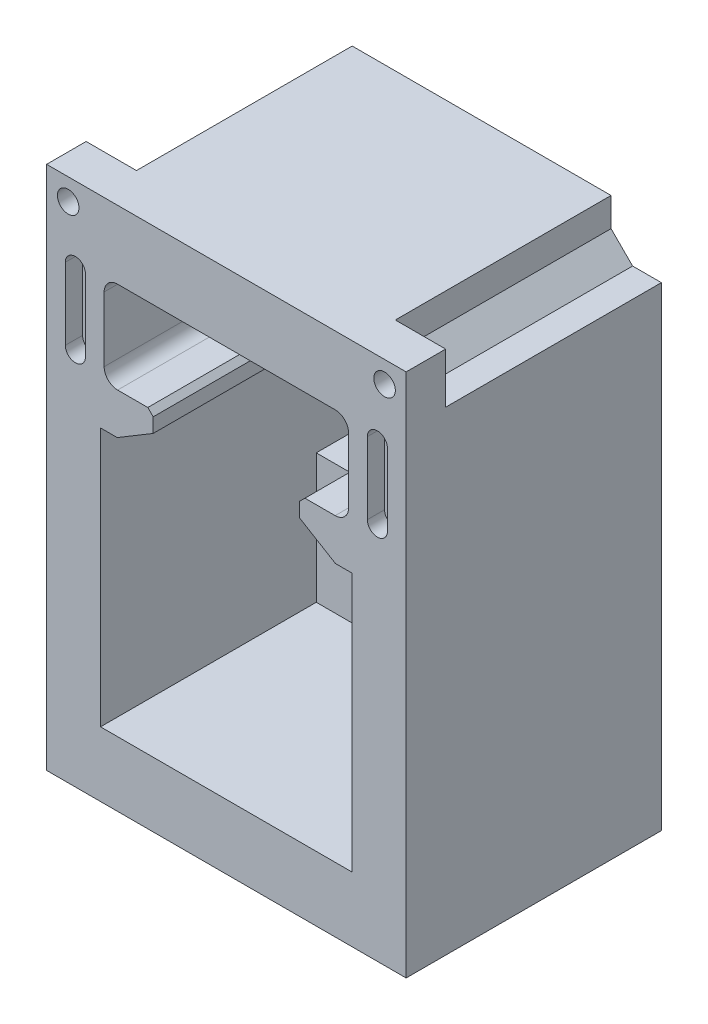
from build123d import *

# Parameters (mm, degrees)
BOSS_EXTRU_1_DEPTH      = 20
CONG_1_R                = 2.38125
ESQUISSE2_W             = 63.5
ESQUISSE2_H             = 35.56
BOSS_EXTRU_2_DEPTH      = 5.08
EMPREINTE1_START        = -25.08
EMPREINTE1_DEPTH        = 5.08
D_PLACER_START          = -25.08
D_PLACER_LA_FACE1_DEPTH = 5.08
EMPREINTE4_START        = 17.46
EMPREINTE4_DEPTH        = 2.54
D_PLACER_START_2        = 16.952
D_PLACER_LA_FACE2_DEPTH = 3.048
CHANFREIN1_SIZE         = 6.35
CHANFREIN1_SIZE2        = 3.81
CHANFREIN2_SIZE         = 3.81
CHANFREIN2_SIZE2        = 6.35
BOSS_EXTRU_3_DEPTH      = 45.08
ESQUISSE4_W             = 44.45
ESQUISSE4_H             = 22.86
ENL_V_MAT_EXTRU_1_DEPTH = 38.1
ESQUISSE5_W             = 12.7
ESQUISSE5_H             = 3.81
BOSS_EXTRU_4_DEPTH      = 12.7
CONG_2_R                = 2.54
D_GAGEMENT_61_D         = 3.7973
ENL_V_START             = -38.1
ENL_V_MAT_EXTRU_2_DEPTH = 119.894566185
D_GAGEMENT_62_D         = 3.7973
D_GAGEMENT_62_DEPTH     = 18.796
D_GAGEMENT_62_TIP       = 1.140824014


# Read off the part's stored shape, not the designer's step: Empreinte1, Déplacer la face1, Empreinte4, Déplacer la face2
with BuildPart() as part:
    # Esquisse1 → Boss.-Extru.1 (new, symmetric)
    with BuildSketch(Plane.XY):
        Polygon((-31.75, -1.905), (-31.75, 33.655), (31.75, 33.655), (31.75, -1.905), (12.92225, -1.905), (12.92225, 4.445), (13.87475, 5.3975), (21.59, 5.3975), (21.59, 21.59), (-21.59, 21.59), (-21.59, 5.3975), (-13.87475, 5.3975), (-12.92225, 4.445), (-12.92225, -1.905), align=None)
    extrude(amount=BOSS_EXTRU_1_DEPTH, both=True)

    # Congé1
    cong_1_edges = [part.edges().sort_by_distance(p)[0] for p in [
        (21.59, 5.3975, 0),
        (21.59, 21.59, 0),
        (-21.59, 21.59, 0),
        (-21.59, 5.3975, 0),
    ]]
    fillet(cong_1_edges, radius=CONG_1_R)

    # Esquisse2 → Boss.-Extru.2 (add)
    with BuildSketch(Plane(origin=(0, 0, -20), x_dir=(-1, 0, 0), z_dir=(0, 0, -1))):
        with Locations((0, 15.875)):
            Rectangle(ESQUISSE2_W, ESQUISSE2_H)
    extrude(amount=BOSS_EXTRU_2_DEPTH)

    # Empreinte1 outline → Empreinte1 (cut)
    with BuildSketch(Plane.XY.offset(EMPREINTE1_START)):
        with BuildLine():
            Line((14.44625, 7.9375), (16.66875, 7.9375))
            ThreePointArc((16.66875, 7.9375), (17.366201977, 9.621298023), (19.05, 10.31875))
            Line((19.05, 10.31875), (19.05, 16.66875))
            ThreePointArc((19.05, 16.66875), (17.366201977, 17.366201977), (16.66875, 19.05))
            Line((16.66875, 19.05), (-16.66875, 19.05))
            ThreePointArc((-16.66875, 19.05), (-17.366201977, 17.366201977), (-19.05, 16.66875))
            Line((-19.05, 16.66875), (-19.05, 10.31875))
            ThreePointArc((-19.05, 10.31875), (-17.366201977, 9.621298023), (-16.66875, 7.9375))
            Line((-16.66875, 7.9375), (-14.44625, 7.9375))
            Line((-14.44625, 7.9375), (-11.90625, 5.3975))
            Line((-11.90625, 5.3975), (-11.90625, -1.905))
            Line((-11.90625, -1.905), (11.90625, -1.905))
            Line((11.90625, -1.905), (11.90625, 5.3975))
            Line((11.90625, 5.3975), (14.44625, 7.9375))
        make_face()
    extrude(amount=EMPREINTE1_DEPTH, mode=Mode.SUBTRACT)

    # Déplacer la face1 outline → Déplacer la face1 (cut)
    with BuildSketch(Plane.XY.offset(D_PLACER_START)):
        with BuildLine():
            Line((-14.867090979, 6.9215), (-12.92225, 4.976659021))
            Line((-12.92225, 4.976659021), (-12.92225, -1.905))
            Line((-12.92225, -1.905), (-11.90625, -1.905))
            Line((-11.90625, -1.905), (-11.90625, 5.3975))
            Line((-11.90625, 5.3975), (-14.44625, 7.9375))
            Line((-14.44625, 7.9375), (-16.66875, 7.9375))
            ThreePointArc((-16.66875, 7.9375), (-17.366201977, 9.621298023), (-19.05, 10.31875))
            Line((-19.05, 10.31875), (-19.05, 16.66875))
            ThreePointArc((-19.05, 16.66875), (-17.366201977, 17.366201977), (-16.66875, 19.05))
            Line((-16.66875, 19.05), (16.66875, 19.05))
            ThreePointArc((16.66875, 19.05), (17.366201977, 17.366201977), (19.05, 16.66875))
            Line((19.05, 16.66875), (19.05, 10.31875))
            ThreePointArc((19.05, 10.31875), (17.366201977, 9.621298023), (16.66875, 7.9375))
            Line((16.66875, 7.9375), (14.44625, 7.9375))
            Line((14.44625, 7.9375), (11.90625, 5.3975))
            Line((11.90625, 5.3975), (11.90625, -1.905))
            Line((11.90625, -1.905), (12.92225, -1.905))
            Line((12.92225, -1.905), (12.92225, 4.976659021))
            Line((12.92225, 4.976659021), (14.867090979, 6.9215))
            Line((14.867090979, 6.9215), (18.13805068, 6.9215))
            ThreePointArc((18.13805068, 6.9215), (18.084622467, 8.902877533), (20.066, 8.84944932))
            Line((20.066, 8.84944932), (20.066, 18.13805068))
            ThreePointArc((20.066, 18.13805068), (18.084622467, 18.084622467), (18.13805068, 20.066))
            Line((18.13805068, 20.066), (-18.13805068, 20.066))
            ThreePointArc((-18.13805068, 20.066), (-18.084622467, 18.084622467), (-20.066, 18.13805068))
            Line((-20.066, 18.13805068), (-20.066, 8.84944932))
            ThreePointArc((-20.066, 8.84944932), (-18.084622467, 8.902877533), (-18.13805068, 6.9215))
            Line((-18.13805068, 6.9215), (-14.867090979, 6.9215))
        make_face()
    extrude(amount=D_PLACER_LA_FACE1_DEPTH, mode=Mode.SUBTRACT)

    # Empreinte4 outline → Empreinte4 (cut)
    with BuildSketch(Plane.XY.offset(EMPREINTE4_START)):
        with BuildLine():
            ThreePointArc((-27.94, 7.62), (-26.67, 6.35), (-25.4, 7.62))
            Line((-25.4, 7.62), (-25.4, 20.32))
            ThreePointArc((-25.4, 20.32), (-26.67, 21.59), (-27.94, 20.32))
            Line((-27.94, 20.32), (-27.94, 7.62))
        make_face()
        with BuildLine():
            Line((25.4, 20.32), (25.4, 7.62))
            ThreePointArc((25.4, 7.62), (26.67, 6.35), (27.94, 7.62))
            Line((27.94, 7.62), (27.94, 20.32))
            ThreePointArc((27.94, 20.32), (26.67, 21.59), (25.4, 20.32))
        make_face()
    extrude(amount=EMPREINTE4_DEPTH, mode=Mode.SUBTRACT)

    # Déplacer la face2 outline → Déplacer la face2 (cut)
    with BuildSketch(Plane.XY.offset(D_PLACER_START_2)):
        with BuildLine():
            ThreePointArc((-28.448, 7.62), (-26.67, 5.842), (-24.892, 7.62))
            Line((-24.892, 7.62), (-24.892, 20.32))
            ThreePointArc((-24.892, 20.32), (-26.67, 22.098), (-28.448, 20.32))
            Line((-28.448, 20.32), (-28.448, 7.62))
        make_face()
        with BuildLine():
            Line((24.892, 20.32), (24.892, 7.62))
            ThreePointArc((24.892, 7.62), (26.67, 5.842), (28.448, 7.62))
            Line((28.448, 7.62), (28.448, 20.32))
            ThreePointArc((28.448, 20.32), (26.67, 22.098), (24.892, 20.32))
        make_face()
    extrude(amount=D_PLACER_LA_FACE2_DEPTH, mode=Mode.SUBTRACT)

    # Chanfrein1
    chanfrein1_edges = [part.edges().sort_by_distance(p)[0] for p in [
        (-12.92225, -1.905, -2.54),
    ]]
    chanfrein1_side = [part.faces().sort_by_distance(p)[0] for p in [
        (-22.336125, -1.905, -2.54),
    ]]
    chamfer(chanfrein1_edges, length=CHANFREIN1_SIZE, length2=CHANFREIN1_SIZE2, reference=chanfrein1_side[0])

    # Chanfrein2
    chanfrein2_edges = [part.edges().sort_by_distance(p)[0] for p in [
        (12.92225, -1.905, -2.54),
    ]]
    chanfrein2_side = [part.faces().sort_by_distance(p)[0] for p in [
        (12.92225, 1.302160596, -2.726935132),
    ]]
    chamfer(chanfrein2_edges, length=CHANFREIN2_SIZE, length2=CHANFREIN2_SIZE2, reference=chanfrein2_side[0])

    # Esquisse3 → Boss.-Extru.3 (add)
    with BuildSketch(Plane.XY.offset(20)):
        Polygon((-31.75, -1.905), (-31.75, -59.055), (31.75, -59.055), (31.75, -1.905), (22.225, -1.905), (22.225, -24.765), (-22.225, -24.765), (-22.225, -1.905), align=None)
    extrude(amount=-BOSS_EXTRU_3_DEPTH)

    # Esquisse4 → Enlèv. mat.-Extru.1 (cut)
    with BuildSketch(Plane.XY.offset(20)):
        with Locations((0, -36.195)):
            Rectangle(ESQUISSE4_W, ESQUISSE4_H)
    extrude(amount=-ENL_V_MAT_EXTRU_1_DEPTH, mode=Mode.SUBTRACT)

    # Esquisse5 → Boss.-Extru.4 (add)
    with BuildSketch(Plane(origin=(0, 0, -25.08), x_dir=(-1, 0, 0), z_dir=(0, 0, -1))):
        with Locations((0, -27.519)):
            Rectangle(ESQUISSE5_W, ESQUISSE5_H)
    extrude(amount=BOSS_EXTRU_4_DEPTH)

    # Congé2
    cong_2_edges = [part.edges().sort_by_distance(p)[0] for p in [
        (6.35, -27.519, -37.78),
        (-6.35, -27.519, -37.78),
    ]]
    fillet(cong_2_edges, radius=CONG_2_R)

    # Dégagement #61 (through all)
    with Locations(Plane(origin=(0, -25.614, 0), x_dir=(1, 0, 0), z_dir=(0, 1, 0))):
        with Locations((0, 31.43)):
            Hole(D_GAGEMENT_61_D / 2)

    # Esquisse8 → Enlèv. mat.-Extru.2 (cut)
    with BuildSketch(Plane(origin=(0, 0, -25.08), x_dir=(-1, 0, 0), z_dir=(0, 0, -1)).offset(ENL_V_START)):
        Polygon((266.493356743, 33.655), (31.75, 33.655), (22.86, 33.655), (22.86, 28.575), (26.67, 24.765), (31.75, 24.765), (266.493356743, 24.765), (735.980070228, 24.765), (735.980070228, 33.655), align=None)
    enl_v_mat_extru_2 = extrude(amount=ENL_V_MAT_EXTRU_2_DEPTH, mode=Mode.SUBTRACT)

    # Symétrie1: Enlèv. mat.-Extru.2 across plane
    add(enl_v_mat_extru_2.mirror(Plane(origin=(0, 0, 0), x_dir=(0, 0, 1), z_dir=(1, 0, 0))), mode=Mode.SUBTRACT)

    # Dégagement #62
    with Locations(Plane(origin=(0, 0, 13.02), x_dir=(-1, 0, 0), z_dir=(0, 0, -1))):
        with Locations((27.94, 29.845), (-27.94, 29.845)):
            Hole(D_GAGEMENT_62_D / 2, depth=D_GAGEMENT_62_DEPTH)
            with Locations((0, 0, -(D_GAGEMENT_62_DEPTH + D_GAGEMENT_62_TIP / 2))):  # 118° drill point
                Cone(0, D_GAGEMENT_62_D / 2, D_GAGEMENT_62_TIP, mode=Mode.SUBTRACT)


solid = part.part
